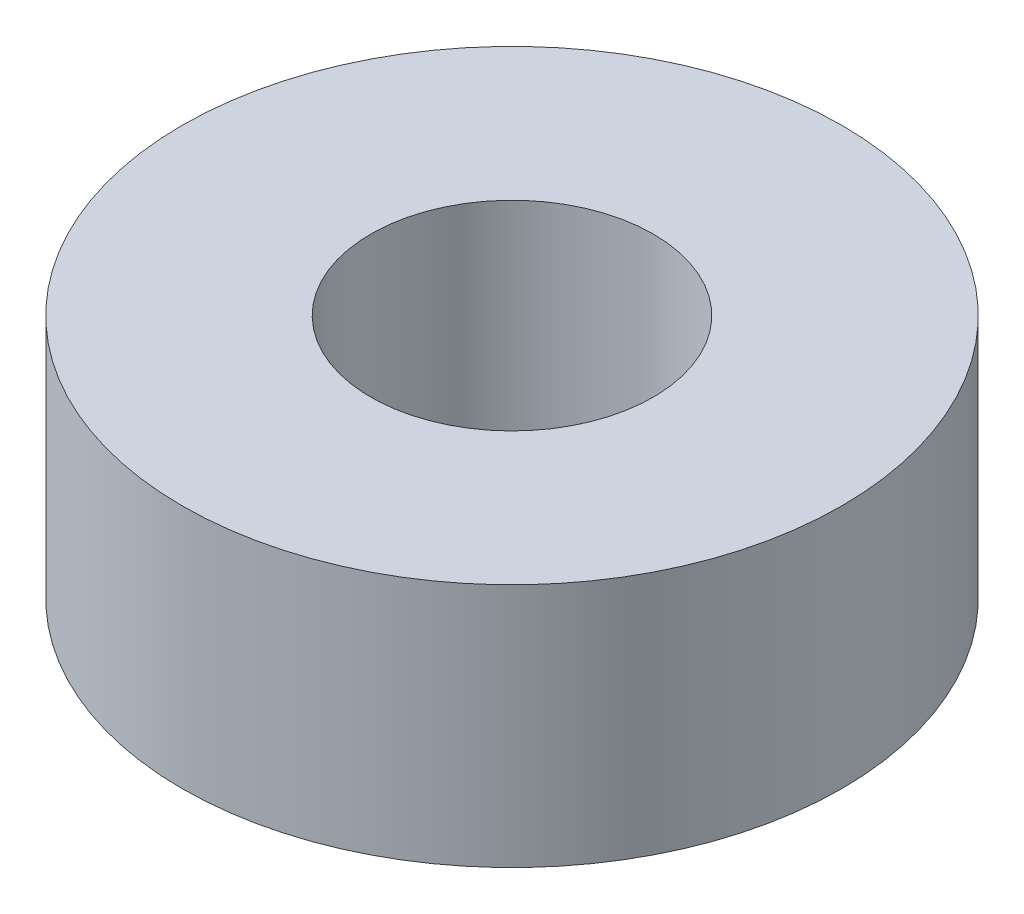
from build123d import *

# Parameters (mm, degrees)
SKETCH1_R           = 17.5
BOSS_EXTRUDE1_DEPTH = 13
SKETCH2_R           = 7.5
CUT_EXTRUDE1_DEPTH  = 28.955321497


with BuildPart() as part:
    # Sketch1 → Boss-Extrude1 (new body)
    with BuildSketch(Plane(origin=(0, 0, 0), x_dir=(1, 0, 0), z_dir=(0, 1, 0))):
        Circle(SKETCH1_R)
    extrude(amount=BOSS_EXTRUDE1_DEPTH)

    # Sketch2 → Cut-Extrude1 (cut, through all)
    with BuildSketch(Plane(origin=(0, 0, 0), x_dir=(1, 0, 0), z_dir=(0, 1, 0))):
        Circle(SKETCH2_R)
    extrude(amount=CUT_EXTRUDE1_DEPTH, mode=Mode.SUBTRACT)


solid = part.part
